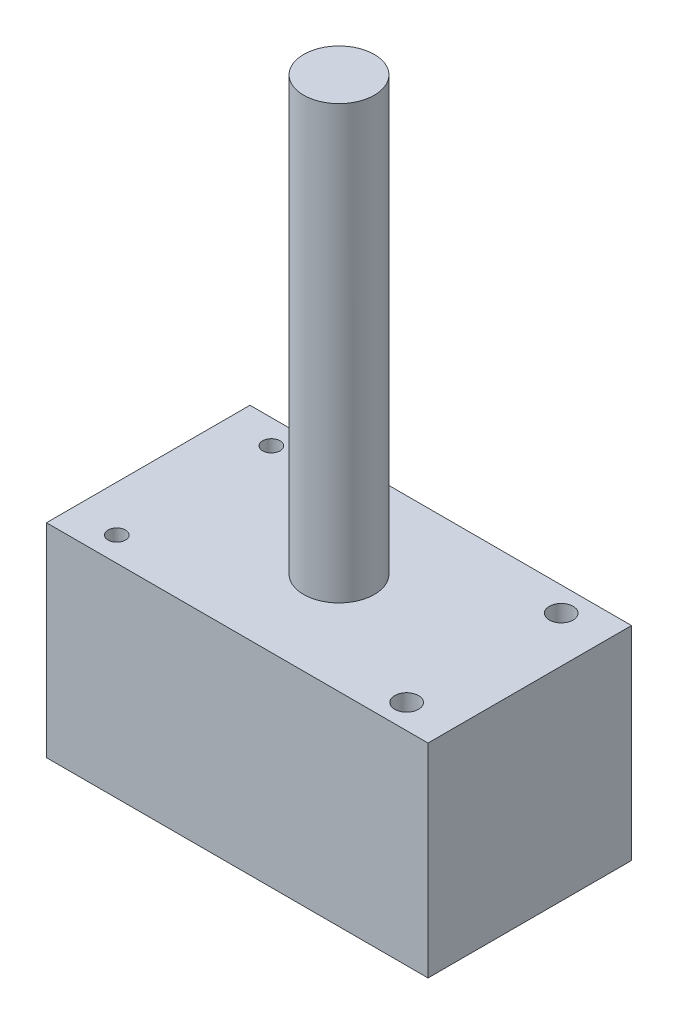
from build123d import *

# Parameters (mm, degrees)
F_01_HOUSING_PROFILE_W      = 135
F_01_HOUSING_PROFILE_H      = 72
F_01_HOUSING_PROFILE_R      = 3.090475378
F_01_HOUSING_PROFILE_R_2    = 4.219723183
F_01_HOUSING_BLOCK_DEPTH    = 72
F_03_OUTPUT_SHAFT_PROFILE_R = 12.5
F_03_OUTPUT_SHAFT_DEPTH     = 225


with BuildPart() as part:
    # 01_Housing_Profile → 01_Housing_Block (new body)
    with BuildSketch(Plane(origin=(0, 0, 0), x_dir=(1, 0, 0), z_dir=(0, 1, 0))):
        Rectangle(F_01_HOUSING_PROFILE_W, F_01_HOUSING_PROFILE_H)
        with Locations((-51.280276817, -27.349480969)):
            Circle(F_01_HOUSING_PROFILE_R, mode=Mode.SUBTRACT)
        with Locations((51.280276817, -27.349480969)):
            Circle(F_01_HOUSING_PROFILE_R_2, mode=Mode.SUBTRACT)
        with Locations((-51.280276817, 27.349480969)):
            Circle(F_01_HOUSING_PROFILE_R, mode=Mode.SUBTRACT)
        with Locations((51.280276817, 27.349480969)):
            Circle(F_01_HOUSING_PROFILE_R_2, mode=Mode.SUBTRACT)
    extrude(amount=F_01_HOUSING_BLOCK_DEPTH)

    # 03_Output_Shaft_Profile → 03_Output_Shaft (add)
    with BuildSketch(Plane(origin=(0, 0, 0), x_dir=(1, 0, 0), z_dir=(0, 1, 0))):
        Circle(F_03_OUTPUT_SHAFT_PROFILE_R)
    extrude(amount=F_03_OUTPUT_SHAFT_DEPTH)


solid = part.part
